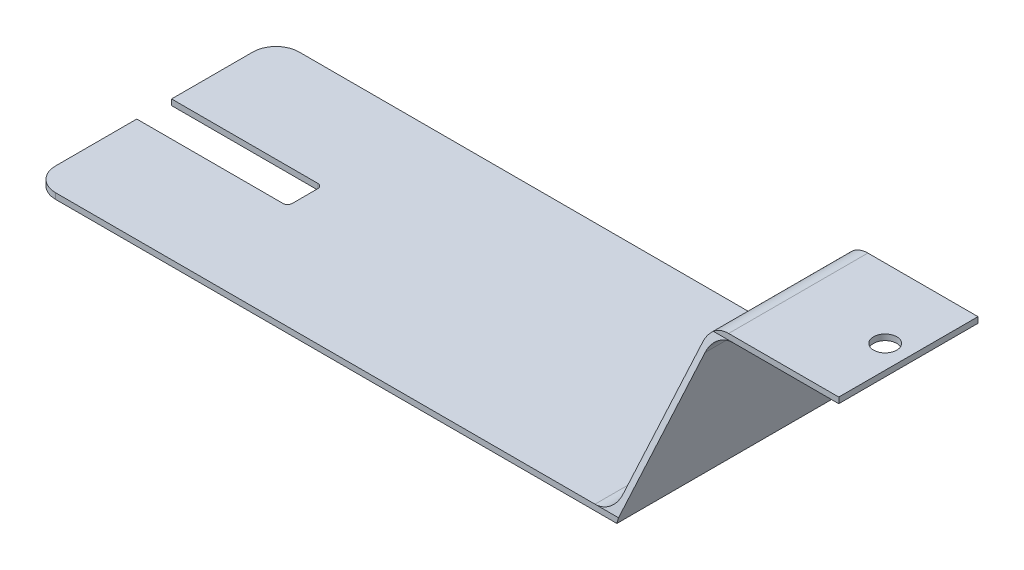
from build123d import *

# Parameters (mm, degrees)
BOSS_EXTRUDE1_DEPTH = 105
CUT_EXTRUDE1_REACH  = 238.485
SKETCH2_W           = 65
SKETCH2_H           = 15
CUT_EXTRUDE12_DEPTH = 281.35970199
FILLET2_R           = 10
FILLET3_R           = 10
FILLET4_R           = 2
CUT_EXTRUDE15_REACH = 239.237
SKETCH13_R          = 5
FILLET5_R           = 10


with BuildPart() as part:
    # Sketch1 → Boss-Extrude1 (new body)
    with BuildSketch(Plane.XY):
        Polygon((-125, -1.25), (125, -1.25), (126.885753532, -1.25), (146.885753532, 68.75), (200, 68.75), (200, 71.25), (145, 71.25), (125, 1.25), (-125, 1.25), align=None)
    extrude(amount=BOSS_EXTRUDE1_DEPTH)

    # Sketch2 → Cut-Extrude1 (cut, up to next)
    with BuildSketch(Plane(origin=(0, 1.25, 0), x_dir=(1, 0, 0), z_dir=(0, 1, 0)), mode=Mode.PRIVATE) as cut_extrude1_sk1:
        with Locations((-92.5, -52.5)):
            Rectangle(SKETCH2_W, SKETCH2_H)
    cut_extrude1_tool1 = extrude(cut_extrude1_sk1.sketch, amount=-CUT_EXTRUDE1_REACH, mode=Mode.PRIVATE) & part.part
    add(cut_extrude1_tool1.solids().sort_by_distance((-92.5, 1.25, 52.5))[0], mode=Mode.SUBTRACT)

    # Sketch11 → Cut-Extrude12 (cut, through all)
    with BuildSketch(Plane(origin=(125, 0, 0), x_dir=(0, 0, -1), z_dir=(1, 0, 0))):
        Polygon((-105, 1.25), (-82.5, 68.75), (-82.5, 71.25), (-105, 71.25), align=None)
        Polygon((-22.5, 71.25), (-22.5, 68.75), (0, 1.25), (0, 71.25), align=None)
    extrude(amount=CUT_EXTRUDE12_DEPTH, mode=Mode.SUBTRACT)

    # Fillet2
    fillet2_edges = [part.edges().sort_by_distance(p)[0] for p in [
        (145, 71.25, 52.5),
        (146.885753532, 68.75, 52.5),
    ]]
    fillet(fillet2_edges, radius=FILLET2_R)

    # Fillet3
    fillet3_edges = [part.edges().sort_by_distance(p)[0] for p in [
        (125, 1.25, 52.5),
    ]]
    fillet(fillet3_edges, radius=FILLET3_R)

    # Fillet4
    fillet4_edges = [part.edges().sort_by_distance(p)[0] for p in [
        (-60, 0, 45),
        (-60, 0, 60),
    ]]
    fillet(fillet4_edges, radius=FILLET4_R)

    # Sketch13 → Cut-Extrude15 (cut, up to next)
    with BuildSketch(Plane(origin=(0, 71.25, 0), x_dir=(1, 0, 0), z_dir=(0, 1, 0)), mode=Mode.PRIVATE) as cut_extrude15_sk1:
        with Locations((190, -52.5)):
            Circle(SKETCH13_R)
    cut_extrude15_tool1 = extrude(cut_extrude15_sk1.sketch, amount=-CUT_EXTRUDE15_REACH, mode=Mode.PRIVATE) & part.part
    add(cut_extrude15_tool1.solids().sort_by_distance((190, 71.25, 52.5))[0], mode=Mode.SUBTRACT)

    # Fillet5
    fillet5_edges = [part.edges().sort_by_distance(p)[0] for p in [
        (-125, 0, 0),
        (-125, 0, 105),
    ]]
    fillet(fillet5_edges, radius=FILLET5_R)


solid = part.part
